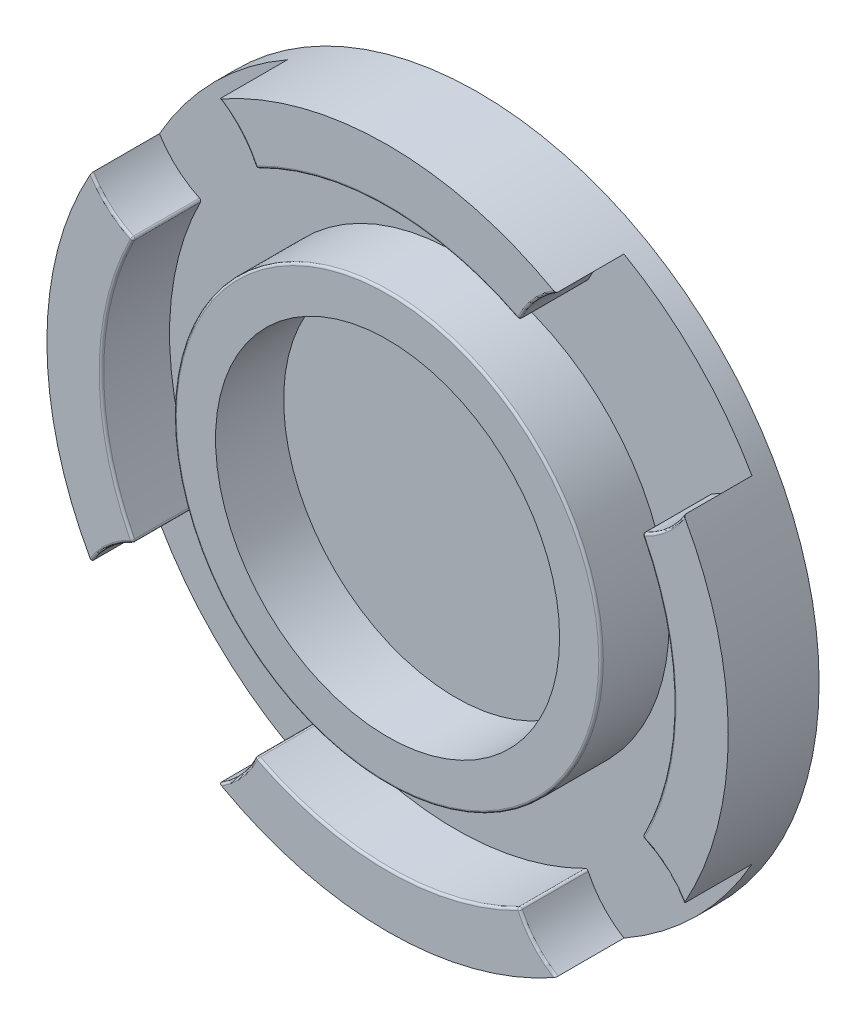
from build123d import *

# Parameters (mm, degrees)
BOSS_EXTRUDE1_DEPTH   = 3
BOSS_EXTRUDE1_2_DEPTH = 3
BOSS_EXTRUDE1_3_DEPTH = 3
BOSS_EXTRUDE1_4_DEPTH = 3
SKETCH1_R             = 9.4
SKETCH1_R_2           = 7.575
BOSS_EXTRUDE1_5_DEPTH = 3
BOSS_EXTRUDE2_START   = -1
SKETCH2_R             = 15
BOSS_EXTRUDE2_DEPTH   = 1
FILLET1_R             = 0.1
FILLET2_R             = 0.1


with BuildPart() as part:
    # Sketch1 → Boss-Extrude1 (new body)
    with BuildSketch(Plane.XY):
        with BuildLine():
            ThreePointArc((5.790318529, 11.190719876), (6.456402483, 12.241261263), (7.406868315, 13.043707363))
            ThreePointArc((7.406868315, 13.043707363), (0, 15), (-7.406868315, 13.043707363))
            ThreePointArc((-7.406868315, 13.043707363), (-6.456402483, 12.241261263), (-5.790318529, 11.190719876))
            ThreePointArc((-5.790318529, 11.190719876), (0, 12.6), (5.790318529, 11.190719876))
        make_face()
    extrude(amount=BOSS_EXTRUDE1_DEPTH)



with BuildPart() as body_2:
    # Sketch1 → Boss-Extrude1 2 (new body)
    with BuildSketch(Plane.XY):
        with BuildLine():
            ThreePointArc((13.043707363, -7.406868315), (14.502682691, -3.830430103), (15, 0))
            ThreePointArc((15, 0), (14.502682691, 3.830430103), (13.043707363, 7.406868315))
            ThreePointArc((13.043707363, 7.406868315), (12.241261263, 6.456402483), (11.190719876, 5.790318529))
            ThreePointArc((11.190719876, 5.790318529), (12.6, 0), (11.190719876, -5.790318529))
            ThreePointArc((11.190719876, -5.790318529), (12.241261263, -6.456402483), (13.043707363, -7.406868315))
        make_face()
    extrude(amount=BOSS_EXTRUDE1_2_DEPTH)


with BuildPart() as body_3:
    # Sketch1 → Boss-Extrude1 3 (new body)
    with BuildSketch(Plane.XY):
        with BuildLine():
            ThreePointArc((-7.406868315, -13.043707363), (0, -15), (7.406868315, -13.043707363))
            ThreePointArc((7.406868315, -13.043707363), (6.456402483, -12.241261263), (5.790318529, -11.190719876))
            ThreePointArc((5.790318529, -11.190719876), (0, -12.6), (-5.790318529, -11.190719876))
            ThreePointArc((-5.790318529, -11.190719876), (-6.456402483, -12.241261263), (-7.406868315, -13.043707363))
        make_face()
    extrude(amount=BOSS_EXTRUDE1_3_DEPTH)


with BuildPart() as body_4:
    # Sketch1 → Boss-Extrude1 4 (new body)
    with BuildSketch(Plane.XY):
        with BuildLine():
            ThreePointArc((-11.190719876, 5.790318529), (-12.241261263, 6.456402483), (-13.043707363, 7.406868315))
            ThreePointArc((-13.043707363, 7.406868315), (-15, 0), (-13.043707363, -7.406868315))
            ThreePointArc((-13.043707363, -7.406868315), (-12.241261263, -6.456402483), (-11.190719876, -5.790318529))
            ThreePointArc((-11.190719876, -5.790318529), (-12.6, 0), (-11.190719876, 5.790318529))
        make_face()
    extrude(amount=BOSS_EXTRUDE1_4_DEPTH)


with BuildPart() as body_5:
    # Sketch1 → Boss-Extrude1 5 (new body)
    with BuildSketch(Plane.XY):
        Circle(SKETCH1_R)
        Circle(SKETCH1_R_2, mode=Mode.SUBTRACT)
    extrude(amount=BOSS_EXTRUDE1_5_DEPTH)


with BuildPart() as part_1:
    add(part.part)

    add(body_2.part)  # Boss-Extrude2 merges body 2

    add(body_3.part)  # Boss-Extrude2 merges body 3

    add(body_4.part)  # Boss-Extrude2 merges body 4

    add(body_5.part)  # Boss-Extrude2 merges body 5
    # Sketch2 → Boss-Extrude2 (add)
    with BuildSketch(Plane.XY.offset(BOSS_EXTRUDE2_START)):
        with Locations(Location((0, 0, 0), (0, 0, 150.409926376))):
            Circle(SKETCH2_R)
    extrude(amount=BOSS_EXTRUDE2_DEPTH)

    # Fillet1
    fillet1_edges = [part_1.edges().sort_by_distance(p)[0] for p in [
        (11.190719876, 5.790318529, 1.5),
        (11.190719876, -5.790318529, 1.5),
        (5.790318529, -11.190719876, 1.5),
        (-5.790318529, -11.190719876, 1.5),
        (-11.190719876, -5.790318529, 1.5),
        (-11.190719876, 5.790318529, 1.5),
        (5.790318529, 11.190719876, 1.5),
        (-5.790318529, 11.190719876, 1.5),
    ]]
    fillet(fillet1_edges, radius=FILLET1_R)

    # Fillet2
    fillet2_edges = [part_1.edges().sort_by_distance(p)[0] for p in [
        (6.490717006, 12.280096445, 3),
        (12.280096445, -6.490717006, 3),
        (-6.490717006, -12.280096445, 3),
        (-12.280096445, 6.490717006, 3),
        (-9.4, 0, 3),
        (0, -12.6, 3),
        (6.490717006, -12.280096445, 3),
        (5.775107932, -11.232998068, 3),
        (-5.775107932, -11.232998068, 3),
        (12.6, 0, 3),
        (12.280096445, 6.490717006, 3),
        (11.232998068, 5.775107932, 3),
        (11.232998068, -5.775107932, 3),
        (0, 12.6, 3),
        (-6.490717006, 12.280096445, 3),
        (-5.775107932, 11.232998068, 3),
        (5.775107932, 11.232998068, 3),
        (-12.6, 0, 3),
        (-12.280096445, -6.490717006, 3),
        (-11.232998068, -5.775107932, 3),
        (-11.232998068, 5.775107932, 3),
    ]]
    fillet(fillet2_edges, radius=FILLET2_R - 0.0001)  # a hair under: the kernel refuses the full size


solid = part_1.part
